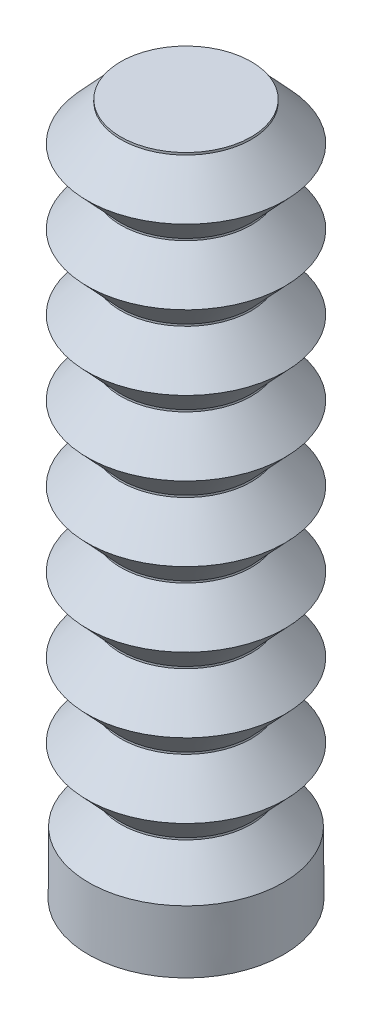
from build123d import *


# Read off the part's stored shape, not the designer's step: Thicken2
with BuildPart() as part:
    # Thicken2 outline → Thicken2 (revolve)
    with BuildSketch(Plane(origin=(-5.431630681, 0, 0), x_dir=(1, 0, 0), z_dir=(0, 0, 1))):
        Polygon((4.120349674, 1.929400611), (4.136521177, -0.904564978), (4.936508153, -0.9), (4.918558927, 2.245501685), (3.3, 3.988409531), (3.3, 4.088409531), (5, 5.913409531), (3.3, 7.738409531), (3.3, 7.838409531), (5, 9.663409531), (3.3, 11.488409531), (3.3, 11.588409531), (5, 13.413409531), (3.3, 15.238409531), (3.3, 15.338409531), (5, 17.163409531), (3.3, 18.988409531), (3.3, 19.088409531), (5, 20.913409531), (3.3, 22.738409531), (3.3, 22.838409531), (5, 24.663409531), (3.3, 26.488409531), (3.3, 26.588409531), (5, 28.413409531), (3.3, 30.238409531), (3.3, 30.338409531), (5, 32.163409531), (3.3, 33.988409531), (3.3, 34.102954004), (0, 34.102954004), (0, 33.302954004), (2.845194483, 33.302954004), (3.906687965, 32.163409531), (2.5, 30.653288628), (2.5, 29.923530434), (3.906687965, 28.413409531), (2.5, 26.903288628), (2.5, 26.173530434), (3.906687965, 24.663409531), (2.5, 23.153288628), (2.5, 22.423530434), (3.906687965, 20.913409531), (2.5, 19.403288628), (2.5, 18.673530434), (3.906687965, 17.163409531), (2.5, 15.653288628), (2.5, 14.923530434), (3.906687965, 13.413409531), (2.5, 11.903288628), (2.5, 11.173530434), (3.906687965, 9.663409531), (2.5, 8.153288628), (2.5, 7.423530434), (3.906687965, 5.913409531), (2.5, 4.403288628), (2.5, 3.674236782), align=None)
    revolve(axis=Axis((-5.431630681, 0, 0), (0, 1, 0)))


solid = part.part
